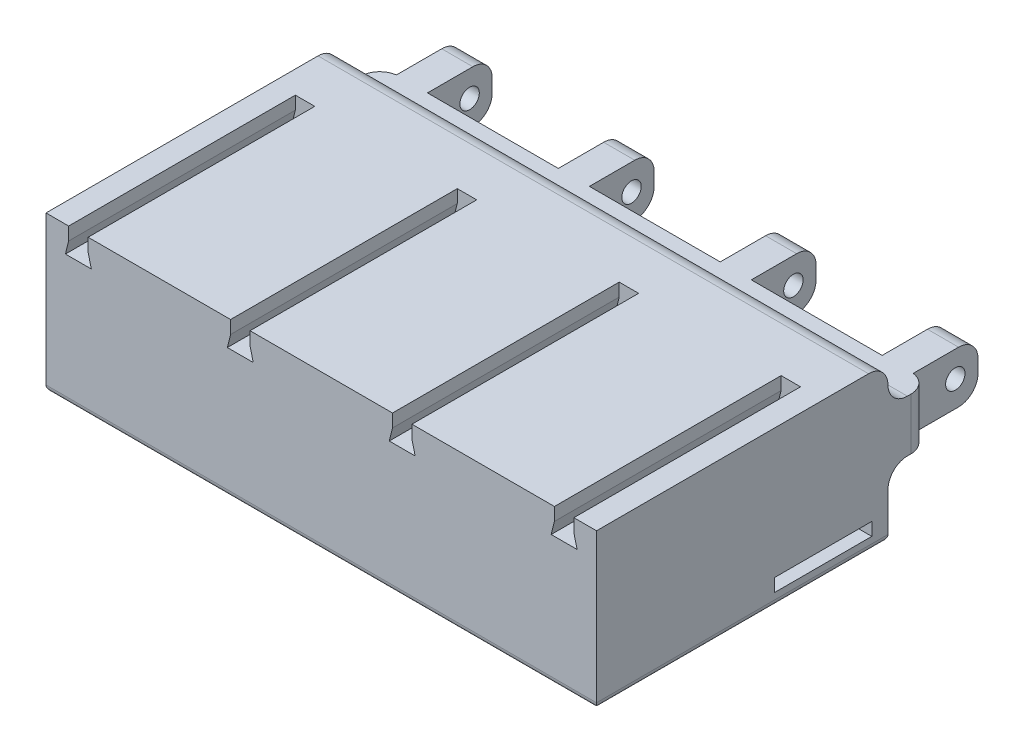
from build123d import *

# Parameters (mm, degrees)
CROQUIS1_R                 = 1.5
SALIENTE_EXTRUIR1_DEPTH    = 42.5
CORTAR_EXTRUIR1_DEPTH      = 78.46128065
CORTAR_EXTRUIR1_DEPTH_BACK = 78.46128065
CROQUIS2_W                 = 2.6
CROQUIS2_H                 = 10
CROQUIS2_W_2               = 20.2
CORTAR_EXTRUIR4_DEPTH      = 78.46128065
CORTAR_EXTRUIR4_DEPTH_BACK = 78.46128065
CROQUIS4_W                 = 15
CROQUIS4_H                 = 2
REDONDEO3_R                = 3
CORTAR_EXTRUIR6_DEPTH      = 35
REDONDEO2_R                = 1


with BuildPart() as part:
    # Croquis1 → Saliente-Extruir1 (new, symmetric)
    with BuildSketch(Plane(origin=(0, 0, 0), x_dir=(0, 0, -1), z_dir=(1, 0, 0))):
        Polygon((-1.5, 9), (-1.5, 1), (-18, 1), (-18, -9), (-63, -9), (-63, 9), (-63, 15), (-18, 15), (-18, 9), align=None)
        with Locations((-5, 5)):
            Circle(CROQUIS1_R, mode=Mode.SUBTRACT)
    extrude(amount=SALIENTE_EXTRUIR1_DEPTH, both=True)

    # Croquis2 → Cortar-Extruir1 (cut, two sides: drawn at the far end of the back side and taken through both)
    with BuildSketch(Plane(origin=(0, 0, 0), x_dir=(1, 0, 0), z_dir=(0, 1, 0)).offset(-CORTAR_EXTRUIR1_DEPTH_BACK)):
        with Locations((-41.2, -6.5)):
            Rectangle(CROQUIS2_W, CROQUIS2_H)
        with Locations((-25, -6.5)):
            Rectangle(CROQUIS2_W_2, CROQUIS2_H)
        with Locations((0, -6.5)):
            Rectangle(CROQUIS2_W_2, CROQUIS2_H)
        with Locations((25, -6.5)):
            Rectangle(CROQUIS2_W_2, CROQUIS2_H)
        with Locations((41.2, -6.5)):
            Rectangle(CROQUIS2_W, CROQUIS2_H)
    extrude(amount=CORTAR_EXTRUIR1_DEPTH + CORTAR_EXTRUIR1_DEPTH_BACK, mode=Mode.SUBTRACT)

    # Croquis4 → Cortar-Extruir4 (cut, two sides: drawn at the far end of the back side and taken through both)
    with BuildSketch(Plane(origin=(0, 0, 0), x_dir=(0, 0, -1), z_dir=(1, 0, 0)).offset(-CORTAR_EXTRUIR4_DEPTH_BACK)):
        with Locations((-28, -6)):
            Rectangle(CROQUIS4_W, CROQUIS4_H)
    extrude(amount=CORTAR_EXTRUIR4_DEPTH + CORTAR_EXTRUIR4_DEPTH_BACK, mode=Mode.SUBTRACT)

    # Redondeo3
    # the kernel refuses this fillet: 3 mm, written as the material it adds along each edge
    with BuildSketch(Plane(origin=(42.5, 1, 18), x_dir=(0, 0, -1), z_dir=(-1, 0, 0)), Plane(origin=(-42.5, 9, 18), x_dir=(0, 0, -1), z_dir=(1, 0, 0))) as redondeo3_piece_1:
        with BuildLine():
            CenterArc((REDONDEO3_R, REDONDEO3_R), REDONDEO3_R, 180, 90)
            Line((0, REDONDEO3_R), (0, 0))
            Line((0, 0), (REDONDEO3_R, 0))
        make_face()
    extrude(amount=85)
    # the kernel refuses this fillet: 3 mm, written as the material it takes off along each edge
    with BuildSketch(Plane(origin=(-47.4, 9, 1.5), x_dir=(0, -1, 0), z_dir=(1, 0, 0)), Plane(origin=(-27.6, 1, 1.5), x_dir=(0, 1, 0), z_dir=(-1, 0, 0))) as redondeo3_2_piece_1:
        with BuildLine():
            CenterArc((REDONDEO3_R, -REDONDEO3_R), REDONDEO3_R, 90, 90)
            Line((0, -REDONDEO3_R), (0, 0))
            Line((0, 0), (REDONDEO3_R, 0))
        make_face()
    extrude(amount=19.8, mode=Mode.SUBTRACT)
    with BuildSketch(Plane(origin=(27.6, 9, 1.5), x_dir=(0, 0, 1), z_dir=(1, 0, 0)), Plane(origin=(47.4, 1, 1.5), x_dir=(0, 0, 1), z_dir=(-1, 0, 0)), Plane(origin=(2.6, 9, 1.5), x_dir=(0, 0, 1), z_dir=(1, 0, 0)), Plane(origin=(22.4, 1, 1.5), x_dir=(0, 0, 1), z_dir=(-1, 0, 0)), Plane(origin=(-22.4, 9, 1.5), x_dir=(0, 0, 1), z_dir=(1, 0, 0)), Plane(origin=(-2.6, 1, 1.5), x_dir=(0, 0, 1), z_dir=(-1, 0, 0))) as redondeo3_2_piece_2:
        with BuildLine():
            CenterArc((REDONDEO3_R, REDONDEO3_R), REDONDEO3_R, 180, 90)
            Line((0, REDONDEO3_R), (0, 0))
            Line((0, 0), (REDONDEO3_R, 0))
        make_face()
    extrude(amount=19.8, mode=Mode.SUBTRACT)
    with BuildSketch(Plane(origin=(42.5, -6.433034374, 11.5), x_dir=(0, 0, 1), z_dir=(0, 1, 0))) as redondeo3_2_piece_3:
        with BuildLine():
            CenterArc((2.973213749, -3), REDONDEO3_R, 90, 82.337744339)
            Line((0, -2.6), (0, 0))
            Line((0, 0), (2.973213749, 0))
        make_face()
    extrude(amount=22.866068747, mode=Mode.SUBTRACT)
    with BuildSketch(Plane(origin=(-42.5, 16.433034374, 11.5), x_dir=(1, 0, 0), z_dir=(0, -1, 0))) as redondeo3_2_piece_4:
        with BuildLine():
            CenterArc((3, 2.973213749), REDONDEO3_R, 180, 82.337744339)
            Line((0, 2.973213749), (0, 0))
            Line((0, 0), (2.6, 0))
        make_face()
    extrude(amount=22.866068747, mode=Mode.SUBTRACT)
    with BuildSketch(Plane(origin=(-50, 15, 18), x_dir=(0, -1, 0), z_dir=(1, 0, 0))) as redondeo3_2_piece_5:
        with BuildLine():
            CenterArc((REDONDEO3_R, -REDONDEO3_R), REDONDEO3_R, 90, 90)
            Line((0, -REDONDEO3_R), (0, 0))
            Line((0, 0), (REDONDEO3_R, 0))
        make_face()
    extrude(amount=100, mode=Mode.SUBTRACT)

    # Croquis5 → Cortar-Extruir6 (cut)
    with BuildSketch(Plane(origin=(0, 0, 63), x_dir=(-1, 0, 0), z_dir=(0, 0, -1))):
        Polygon((11, 13), (10.5, 11), (14.5, 11), (14, 13), (14, 15), (11, 15), align=None)
        Polygon((-39, 13), (-39.5, 11), (-35.5, 11), (-36, 13), (-36, 15), (-39, 15), align=None)
        Polygon((36, 15), (39, 15), (39, 13), (39.5, 11), (35.5, 11), (36, 13), align=None)
        Polygon((-11, 15), (-14, 15), (-14, 13), (-14.5, 11), (-10.5, 11), (-11, 13), align=None)
    extrude(amount=CORTAR_EXTRUIR6_DEPTH, mode=Mode.SUBTRACT)

    # Redondeo2
    redondeo2_edges = [part.edges().sort_by_distance(p)[0] for p in [
        (-42.5, -9, 40.5),
        (0, -9, 18),
        (0, -9, 63),
        (42.5, -9, 40.5),
    ]]
    fillet(redondeo2_edges, radius=REDONDEO2_R)


solid = part.part
